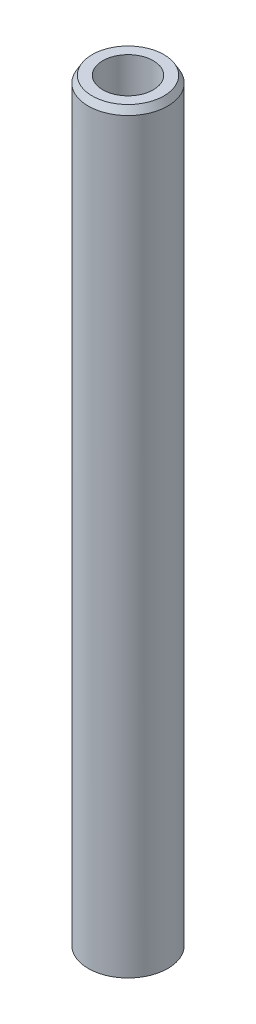
from build123d import *
from OCP.BRepFilletAPI import BRepFilletAPI_MakeChamfer

# Parameters (mm, degrees)
SKETCH1_R           = 22.5
BOSS_EXTRUDE1_DEPTH = 428.557441442
SKETCH2_R           = 14.292877338
CUT_EXTRUDE1_DEPTH  = 430.737106398
CHAMFER1_SIZE       = 3.843624028
CHAMFER1_SIZE2      = 2.219117367


with BuildPart() as part:
    # Sketch1 → Boss-Extrude1 (new body)
    with BuildSketch(Plane(origin=(0, 0, 0), x_dir=(1, 0, 0), z_dir=(0, 1, 0))):
        Circle(SKETCH1_R)
    extrude(amount=BOSS_EXTRUDE1_DEPTH)

    # Sketch2 → Cut-Extrude1 (cut, through all)
    with BuildSketch(Plane(origin=(0, 0, 0), x_dir=(1, 0, 0), z_dir=(0, 1, 0))):
        Circle(SKETCH2_R)
    extrude(amount=CUT_EXTRUDE1_DEPTH, mode=Mode.SUBTRACT)

    # Chamfer1: one chamfer whose edges measure the first distance from different faces: ONE call of the kernel's chamfer builder (chamfer() names one face for all edges)
    chamfer1_edges_1 = [part.edges().sort_by_distance(p)[0] for p in [
        (-22.5, 428.557441442, 0),
    ]]
    chamfer1_side_1 = [part.faces().sort_by_distance(p)[0] for p in [
        (-22.5, 214.278720721, 0),
    ]]
    chamfer1_edges_2 = [part.edges().sort_by_distance(p)[0] for p in [
        (-22.5, 0, 0),
    ]]
    chamfer1_side_2 = [part.faces().sort_by_distance(p)[0] for p in [
        (-21.863603897, 0, 0),
    ]]
    chamfer1 = BRepFilletAPI_MakeChamfer(part.part.solid().wrapped)
    for e in chamfer1_edges_1:
        chamfer1.Add(CHAMFER1_SIZE, CHAMFER1_SIZE2, e.wrapped, chamfer1_side_1[0].wrapped)  # the first distance lies on this face
    for e in chamfer1_edges_2:
        chamfer1.Add(CHAMFER1_SIZE, CHAMFER1_SIZE2, e.wrapped, chamfer1_side_2[0].wrapped)  # the first distance lies on this face
    add(Compound.cast(chamfer1.Shape()), mode=Mode.REPLACE)


solid = part.part
